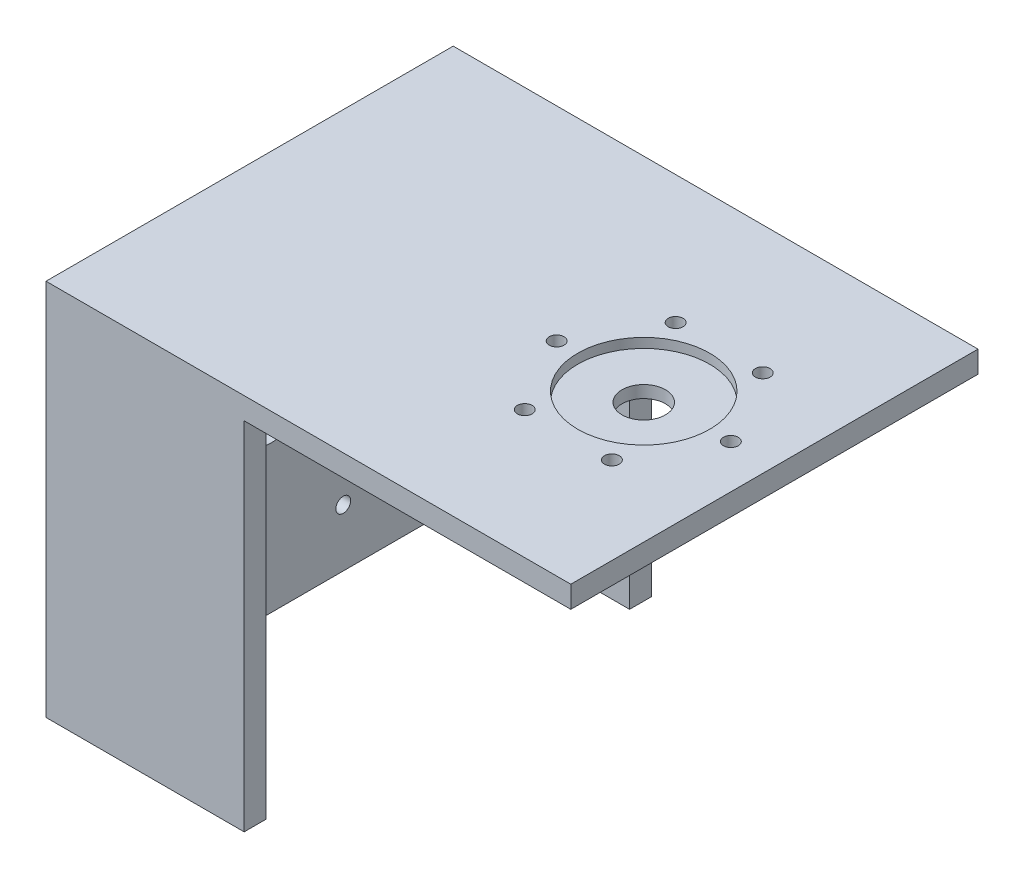
from build123d import *

# Parameters (mm, degrees)
SK_OUTPUT_PLATE_W        = 120.5
SK_OUTPUT_PLATE_H        = 93.5
SK_OUTPUT_PLATE_R        = 1.7
SK_OUTPUT_PLATE_R_2      = 5
OUTPUT_PLATE_DEPTH       = 5
SK_PITCH_PILOT_RECESS_R  = 15.15
PITCH_PILOT_RECESS_DEPTH = 2.2
SK_REAR_PLATE_W          = 93.5
SK_REAR_PLATE_H          = 86.75
SK_REAR_PLATE_R          = 8
SK_REAR_PLATE_R_2        = 1.7
REAR_PLATE_DEPTH         = 5
SK_TOP_PLATE_W           = 45.5
SK_TOP_PLATE_H           = 86.75
TOP_PLATE_DEPTH          = 5
SK_BOTTOM_PLATE_W        = 45.5
SK_BOTTOM_PLATE_H        = 86.75
BOTTOM_PLATE_DEPTH       = 5


with BuildPart() as part:
    # SK_Output_Plate → Output_Plate (new body)
    with BuildSketch(Plane(origin=(0, -5, 0), x_dir=(1, 0, 0), z_dir=(0, 1, 0))):
        with Locations((-30.25, 0)):
            Rectangle(SK_OUTPUT_PLATE_W, SK_OUTPUT_PLATE_H)
        with Locations((20, 0)):
            Circle(SK_OUTPUT_PLATE_R, mode=Mode.SUBTRACT)
        with Locations((10, 17.320508076)):
            Circle(SK_OUTPUT_PLATE_R, mode=Mode.SUBTRACT)
        with Locations((-10, 17.320508076)):
            Circle(SK_OUTPUT_PLATE_R, mode=Mode.SUBTRACT)
        with Locations((-20, 0)):
            Circle(SK_OUTPUT_PLATE_R, mode=Mode.SUBTRACT)
        with Locations((-10, -17.320508076)):
            Circle(SK_OUTPUT_PLATE_R, mode=Mode.SUBTRACT)
        with Locations((10, -17.320508076)):
            Circle(SK_OUTPUT_PLATE_R, mode=Mode.SUBTRACT)
        Circle(SK_OUTPUT_PLATE_R_2, mode=Mode.SUBTRACT)
    extrude(amount=OUTPUT_PLATE_DEPTH)

    # SK_Pitch_Pilot_Recess → Pitch_Pilot_Recess (cut)
    with BuildSketch(Plane(origin=(0, 0, 0), x_dir=(1, 0, 0), z_dir=(0, 1, 0))):
        Circle(SK_PITCH_PILOT_RECESS_R)
    extrude(amount=-PITCH_PILOT_RECESS_DEPTH, mode=Mode.SUBTRACT)

    # SK_Rear_Plate → Rear_Plate (add)
    with BuildSketch(Plane(origin=(-90.5, 0, 0), x_dir=(0, 0, -1), z_dir=(1, 0, 0))):
        with Locations((0, -43.375)):
            Rectangle(SK_REAR_PLATE_W, SK_REAR_PLATE_H)
        with Locations((0, -45)):
            Circle(SK_REAR_PLATE_R, mode=Mode.SUBTRACT)
        with Locations((33, -45)):
            Circle(SK_REAR_PLATE_R_2, mode=Mode.SUBTRACT)
        with Locations((16.5, -73.578838325)):
            Circle(SK_REAR_PLATE_R_2, mode=Mode.SUBTRACT)
        with Locations((-16.5, -73.578838325)):
            Circle(SK_REAR_PLATE_R_2, mode=Mode.SUBTRACT)
        with Locations((-33, -45)):
            Circle(SK_REAR_PLATE_R_2, mode=Mode.SUBTRACT)
        with Locations((-16.5, -16.421161675)):
            Circle(SK_REAR_PLATE_R_2, mode=Mode.SUBTRACT)
        with Locations((16.5, -16.421161675)):
            Circle(SK_REAR_PLATE_R_2, mode=Mode.SUBTRACT)
    extrude(amount=REAR_PLATE_DEPTH)

    # SK_Top_Plate → Top_Plate (add)
    with BuildSketch(Plane.XY.offset(41.75)):
        with Locations((-67.75, -43.375)):
            Rectangle(SK_TOP_PLATE_W, SK_TOP_PLATE_H)
    extrude(amount=TOP_PLATE_DEPTH)

    # SK_Bottom_Plate → Bottom_Plate (add)
    with BuildSketch(Plane.XY.offset(-46.75)):
        with Locations((-67.75, -43.375)):
            Rectangle(SK_BOTTOM_PLATE_W, SK_BOTTOM_PLATE_H)
    extrude(amount=BOTTOM_PLATE_DEPTH)


solid = part.part
